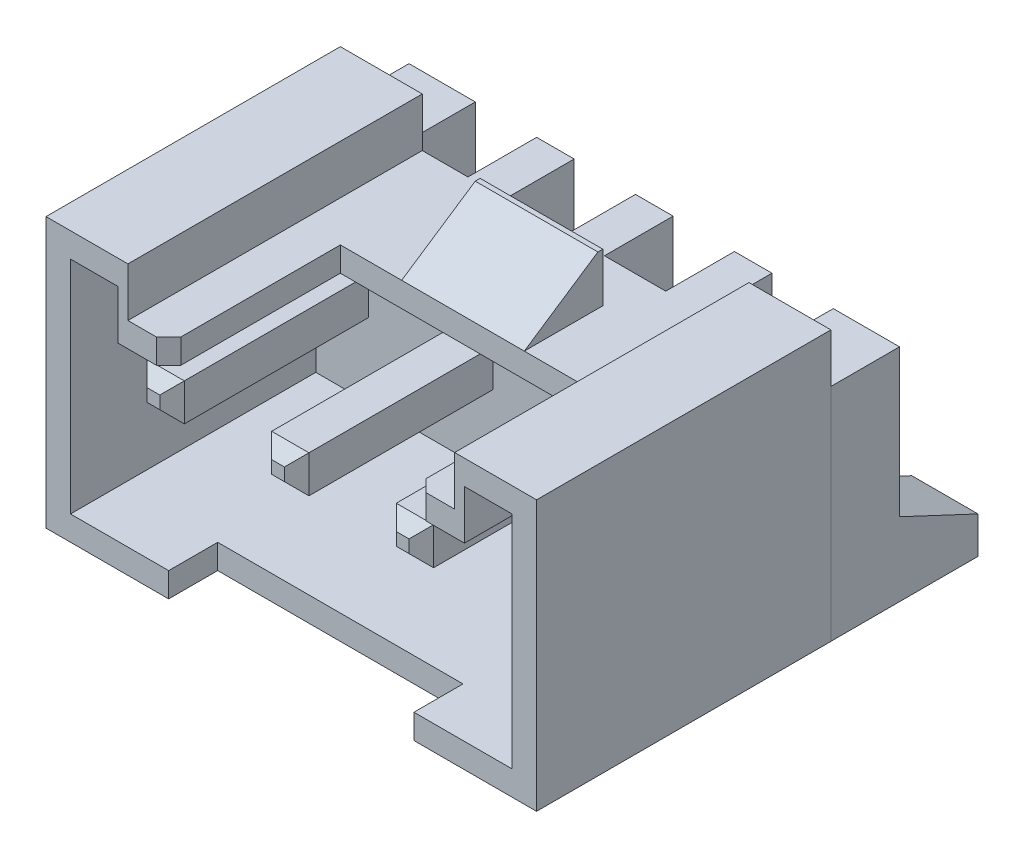
from build123d import *

# Parameters (mm, degrees)
BOSS_EXTRU_1_DEPTH      = 6
BOSS_EXTRU_2_DEPTH      = 1.25
BOSS_EXTRU_2_DEPTH_BACK = 1.25
BOSS_EXTRU_3_DEPTH      = 1
ESQUISSE4_W             = 9.998484941
ESQUISSE4_H             = 1.4
BOSS_EXTRU_4_DEPTH      = 4.5
ESQUISSE6_W             = 1.25
ESQUISSE6_H             = 4.5
ENL_V_MAT_EXTRU_1_DEPTH = 0.7
CHANFREIN1_SIZE         = 0.7
BOSS_EXTRU_5_DEPTH      = 1.351515059
BOSS_EXTRU_6_DEPTH      = 1.35
ESQUISSE9_W             = 0.76
ESQUISSE9_H             = 0.76
BOSS_EXTRU_7_DEPTH      = 4
CHANFREIN2_SIZE         = 0.25
ENL_V_MAT_EXTRU_2_REACH = 11.014
ESQUISSE10_W            = 5
ESQUISSE10_H            = 3.75
CHANFREIN3_SIZE         = 0.25
ENL_V_MAT_EXTRU_3_REACH = 11.274
ESQUISSE11_W            = 5
ESQUISSE11_H            = 1.25


with BuildPart() as part:
    # Esquisse1 → Boss.-Extru.1 (new body)
    with BuildSketch(Plane.XY):
        Polygon((5, 0), (-5, 0), (-5, 5.5), (-3.33, 5.5), (-3.33, 4.5), (3.33, 4.5), (3.33, 5.5), (5, 5.5), align=None)
        Polygon((-4.5, 5), (-3.53, 5), (-3.53, 4), (3.53, 4), (3.53, 5), (4.5, 5), (4.5, 0.5), (-4.5, 0.5), align=None, mode=Mode.SUBTRACT)
    extrude(amount=BOSS_EXTRU_1_DEPTH)

    # Esquisse2 → Boss.-Extru.2 (add, two sides: drawn at the far end of the back side and taken through both)
    with BuildSketch(Plane(origin=(0, 0, 0), x_dir=(0, 0, -1), z_dir=(1, 0, 0)).offset(-BOSS_EXTRU_2_DEPTH_BACK)):
        Polygon((-1, 5.5), (-2.5, 4.5), (-0.9, 4.5), (-0.9, 5.5), align=None)
    extrude(amount=BOSS_EXTRU_2_DEPTH + BOSS_EXTRU_2_DEPTH_BACK)

    # Esquisse3 → Boss.-Extru.3 (add)
    with BuildSketch(Plane(origin=(0, 0, 0), x_dir=(-1, 0, 0), z_dir=(0, 0, -1))):
        Polygon((-3.33, 5.5), (-5, 5.5), (-5, 0), (5, 0), (5, 5.5), (3.33, 5.5), (3.33, 4.5), (-3.33, 4.5), align=None)
    extrude(amount=-BOSS_EXTRU_3_DEPTH)

    # Esquisse4 → Boss.-Extru.4 (add)
    with BuildSketch(Plane(origin=(0, 4.5, 0), x_dir=(1, 0, 0), z_dir=(0, 1, 0))):
        with Locations((-0.000757529, 0.7)):
            Rectangle(ESQUISSE4_W, ESQUISSE4_H)
    extrude(amount=-BOSS_EXTRU_4_DEPTH)

    # Esquisse6 → Enlèv. mat.-Extru.1 (cut)
    with BuildSketch(Plane(origin=(0, 0, -1.4), x_dir=(-1, 0, 0), z_dir=(0, 0, -1))):
        with Locations((-3.023484941, 2.25)):
            Rectangle(ESQUISSE6_W, ESQUISSE6_H)
        with Locations((1.008484941, 2.25)):
            Rectangle(ESQUISSE6_W, ESQUISSE6_H)
        with Locations((-1.008484941, 2.25)):
            Rectangle(ESQUISSE6_W, ESQUISSE6_H)
        with Locations((3.023484941, 2.25)):
            Rectangle(ESQUISSE6_W, ESQUISSE6_H)
    extrude(amount=-ENL_V_MAT_EXTRU_1_DEPTH, mode=Mode.SUBTRACT)

    # Chanfrein1
    chanfrein1_edges = [part.edges().sort_by_distance(p)[0] for p in [
        (3.023484941, 4.5, -0.7),
        (1.008484941, 4.5, -0.7),
        (-1.008484941, 4.5, -0.7),
        (-3.023484941, 4.5, -0.7),
    ]]
    chamfer(chanfrein1_edges, length=CHANFREIN1_SIZE - 0.0001)  # a hair under: the kernel refuses the full size

    # Esquisse7 → Boss.-Extru.5 (add)
    with BuildSketch(Plane.ZY.offset(5)):
        Polygon((-1.4, 0), (-3, 0), (-3, 0.75), (-1.4, 1.5), align=None)
    extrude(amount=-BOSS_EXTRU_5_DEPTH)

    # Esquisse8 → Boss.-Extru.6 (add)
    with BuildSketch(Plane(origin=(4.998484941, 0, 0), x_dir=(0, 0, -1), z_dir=(1, 0, 0))):
        Polygon((1.4, 0), (3, 0), (3, 0.75), (1.4, 1.5), align=None)
    extrude(amount=-BOSS_EXTRU_6_DEPTH)

    # Esquisse9 → Boss.-Extru.7 (add)
    with BuildSketch(Plane.XY.offset(1)):
        with Locations((-1.27, 2.38)):
            Rectangle(ESQUISSE9_W, ESQUISSE9_H)
        with Locations((3.81, 2.38)):
            Rectangle(ESQUISSE9_W, ESQUISSE9_H)
        with Locations((-3.81, 2.38)):
            Rectangle(ESQUISSE9_W, ESQUISSE9_H)
        with Locations((1.27, 2.38)):
            Rectangle(ESQUISSE9_W, ESQUISSE9_H)
    extrude(amount=BOSS_EXTRU_7_DEPTH)

    # Chanfrein2
    chanfrein2_edges = [part.edges().sort_by_distance(p)[0] for p in [
        (-1.65, 2.38, 5),
        (-1.27, 2, 5),
        (-0.89, 2.38, 5),
        (-1.27, 2.76, 5),
        (-3.43, 2.38, 5),
        (-3.81, 2.76, 5),
        (-4.19, 2.38, 5),
        (-3.81, 2, 5),
        (3.81, 2, 5),
        (4.19, 2.38, 5),
        (3.81, 2.76, 5),
        (3.43, 2.38, 5),
        (1.27, 2.76, 5),
        (0.89, 2.38, 5),
        (1.27, 2, 5),
        (1.65, 2.38, 5),
    ]]
    chamfer(chanfrein2_edges, length=CHANFREIN2_SIZE)

    # Esquisse10 → Enlèv. mat.-Extru.2 (cut, up to next)
    with BuildSketch(Plane(origin=(0, 4.5, 0), x_dir=(1, 0, 0), z_dir=(0, 1, 0)), mode=Mode.PRIVATE) as enl_v_mat_extru_2_sk1:
        with Locations((0, -4.375)):
            Rectangle(ESQUISSE10_W, ESQUISSE10_H)
    enl_v_mat_extru_2_tool1 = extrude(enl_v_mat_extru_2_sk1.sketch, amount=-ENL_V_MAT_EXTRU_2_REACH, mode=Mode.PRIVATE) & part.part
    add(enl_v_mat_extru_2_tool1.solids().sort_by_distance((0, 4.5, 4.375))[0], mode=Mode.SUBTRACT)

    # Chanfrein3
    chanfrein3_edges = [part.edges().sort_by_distance(p)[0] for p in [
        (2.5, 4.25, 6),
        (-2.5, 4.25, 6),
    ]]
    chamfer(chanfrein3_edges, length=CHANFREIN3_SIZE)

    # Esquisse11 → Enlèv. mat.-Extru.3 (cut, up to next)
    with BuildSketch(Plane(origin=(0, 0.5, 0), x_dir=(1, 0, 0), z_dir=(0, 1, 0)), mode=Mode.PRIVATE) as enl_v_mat_extru_3_sk1:
        with Locations((0, -5.625)):
            Rectangle(ESQUISSE11_W, ESQUISSE11_H)
    enl_v_mat_extru_3_tool1 = extrude(enl_v_mat_extru_3_sk1.sketch, amount=-ENL_V_MAT_EXTRU_3_REACH, mode=Mode.PRIVATE) & part.part
    add(enl_v_mat_extru_3_tool1.solids().sort_by_distance((0, 0.5, 5.625))[0], mode=Mode.SUBTRACT)


solid = part.part
